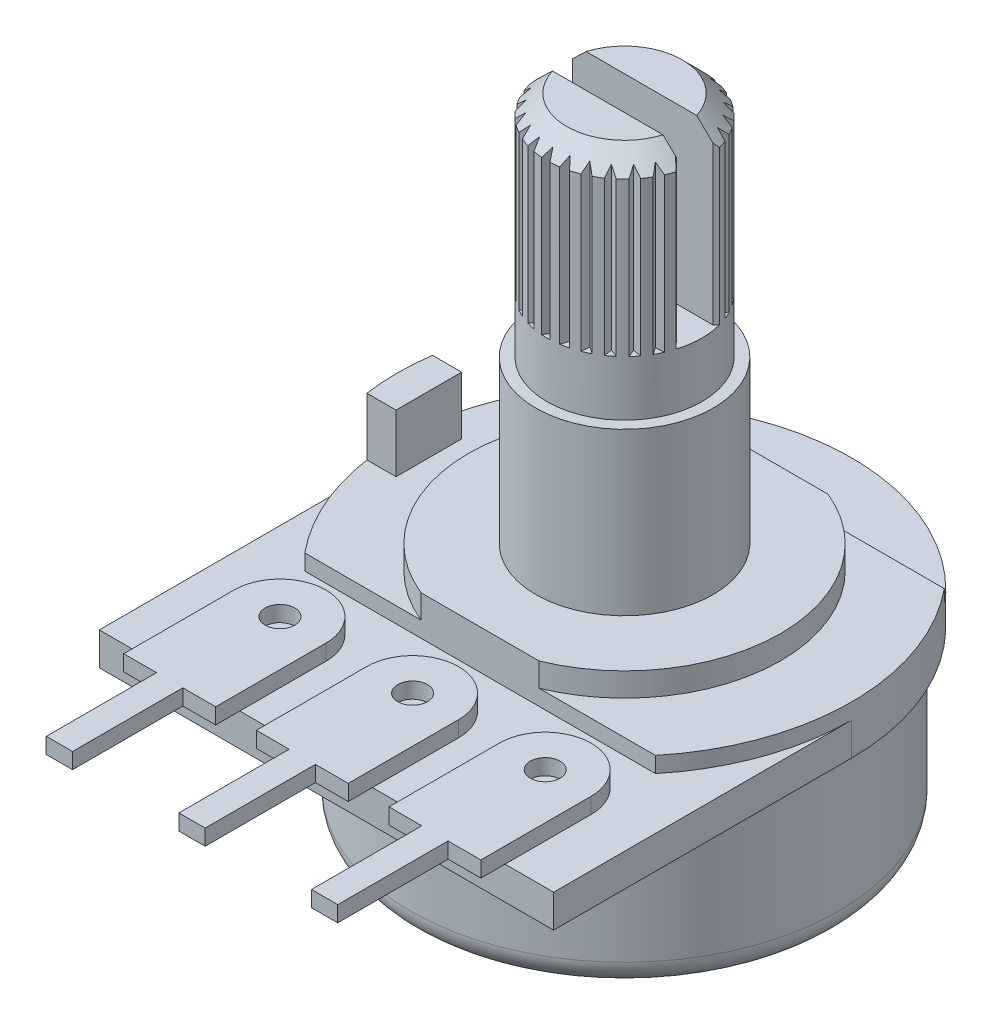
from build123d import *
from build123d.topology import SkipClean

# Parameters (mm, degrees)
CROQUIS1_R                = 8.15
SALIENTE_EXTRUIR1_DEPTH   = 6.3
REDONDEO1_R               = 1
SALIENTE_EXTRUIR2_DEPTH   = 1.25
CROQUIS11_W               = 3.9913563
CROQUIS11_H               = 2
CORTAR_EXTRUIR3_DEPTH     = 2.6
CROQUIS3_R                = 0.565497453
SALIENTE_EXTRUIR3_DEPTH   = 0.6
SALIENTE_EXTRUIR3_2_DEPTH = 0.6
SALIENTE_EXTRUIR3_3_DEPTH = 0.6
SALIENTE_EXTRUIR4_DEPTH   = 0.6
SALIENTE_EXTRUIR5_DEPTH   = 0.9
CROQUIS6_R                = 3.375
SALIENTE_EXTRUIR6_DEPTH   = 6.15
CROQUIS7_R                = 2.95
SALIENTE_EXTRUIR7_DEPTH   = 8.7
CHAFL_N1_SIZE             = 0.75
CROQUIS8_W                = 13.62856302
CROQUIS8_H                = 1.28
CORTAR_EXTRUIR1_DEPTH     = 6.6
CORTAR_EXTRUIR2_DEPTH     = 6.6
SALIENTE_EXTRUIR8_DEPTH   = 2.2


with BuildPart() as part:
    # Croquis1 → Saliente-Extruir1 (new body)
    with BuildSketch(Plane(origin=(0, 0, 0), x_dir=(1, 0, 0), z_dir=(0, 1, 0))):
        Circle(CROQUIS1_R)
    extrude(amount=SALIENTE_EXTRUIR1_DEPTH)

    # Redondeo1
    redondeo1_edges = [part.edges().sort_by_distance(p)[0] for p in [
        (-8.15, 0, 0),
    ]]
    fillet(redondeo1_edges, radius=REDONDEO1_R)

    # Croquis2 → Saliente-Extruir2 (add)
    with BuildSketch(Plane(origin=(0, 6.3, 0), x_dir=(1, 0, 0), z_dir=(0, 1, 0))):
        with BuildLine():
            Line((-8.65, 0), (-8.65, -11.35))
            Line((-8.65, -11.35), (8.65, -11.35))
            Line((8.65, -11.35), (8.65, 0))
            ThreePointArc((8.65, 0), (0, 8.65), (-8.65, 0))
        make_face()
    extrude(amount=SALIENTE_EXTRUIR2_DEPTH)

    # Croquis11 → Cortar-Extruir3 (cut)
    with BuildSketch(Plane.XZ):
        with Locations((-8.65, 0)):
            Rectangle(CROQUIS11_W, CROQUIS11_H)
    extrude(amount=-CORTAR_EXTRUIR3_DEPTH, mode=Mode.SUBTRACT)

    # Croquis4 → Saliente-Extruir4 (add)
    with BuildSketch(Plane(origin=(0, 7.55, 0), x_dir=(1, 0, 0), z_dir=(0, 1, 0))):
        with BuildLine():
            Line((-6.676263925, -5.5), (6.676263925, -5.5))
            ThreePointArc((6.676263925, -5.5), (8.65, 0), (6.676263925, 5.5))
            Line((6.676263925, 5.5), (-6.676263925, 5.5))
            ThreePointArc((-6.676263925, 5.5), (-8.65, 0), (-6.676263925, -5.5))
        make_face()
    extrude(amount=SALIENTE_EXTRUIR4_DEPTH)

    # Croquis5 → Saliente-Extruir5 (add)
    with BuildSketch(Plane(origin=(0, 8.15, 0), x_dir=(1, 0, 0), z_dir=(0, 1, 0))):
        with BuildLine():
            Line((-2.25, 5.5), (2.25, 5.5))
            ThreePointArc((2.25, 5.5), (5.942432162, 0), (2.25, -5.5))
            Line((2.25, -5.5), (-2.25, -5.5))
            ThreePointArc((-2.25, -5.5), (-5.942432162, 0), (-2.25, 5.5))
        make_face()
    extrude(amount=SALIENTE_EXTRUIR5_DEPTH)

    # Croquis6 → Saliente-Extruir6 (add)
    with BuildSketch(Plane(origin=(0, 9.05, 0), x_dir=(1, 0, 0), z_dir=(0, 1, 0))):
        Circle(CROQUIS6_R)
    extrude(amount=SALIENTE_EXTRUIR6_DEPTH)

    # Croquis7 → Saliente-Extruir7 (add)
    with BuildSketch(Plane(origin=(0, 15.2, 0), x_dir=(1, 0, 0), z_dir=(0, 1, 0))):
        Circle(CROQUIS7_R)
    extrude(amount=SALIENTE_EXTRUIR7_DEPTH)

    # Chaflán1
    chafl_n1_edges = [part.edges().sort_by_distance(p)[0] for p in [
        (-2.95, 23.9, 0),
    ]]
    chamfer(chafl_n1_edges, length=CHAFL_N1_SIZE)

    # Croquis8 → Cortar-Extruir1 (cut)
    with BuildSketch(Plane(origin=(0, 23.9, 0), x_dir=(1, 0, 0), z_dir=(0, 1, 0))):
        Rectangle(CROQUIS8_W, CROQUIS8_H)
    extrude(amount=-CORTAR_EXTRUIR1_DEPTH, mode=Mode.SUBTRACT)

    # Croquis9 → Cortar-Extruir2 (cut)
    with BuildSketch(Plane(origin=(0, 23.9, 0), x_dir=(1, 0, 0), z_dir=(0, 1, 0))):
        Polygon((0.05460617, 2.669961994), (0.313994159, 3.11923517), (-0.204781819, 3.11923517), align=None)
        Polygon((0.647359516, 2.590869457), (1.000216793, 2.971159158), (0.494447612, 3.086597673), align=None)
        Polygon((1.207651553, 2.381859906), (1.63628438, 2.67409682), (1.168883375, 2.899185281), align=None)
        Polygon((1.707386898, 2.053413954), (2.190301837, 2.242944101), (1.784706445, 2.566395633), align=None)
        Polygon((2.121506734, 1.622001252), (2.634488413, 1.699320799), (2.311036881, 2.104916191), align=None)
        Polygon((2.429245365, 1.109254634), (2.946570739, 1.070486457), (2.721482279, 1.537887462), align=None)
        Polygon((2.615171489, 0.540885357), (3.110899705, 0.387973454), (2.99546119, 0.893742634), align=None)
        Polygon((2.669961995, -0.05460617), (3.11923517, -0.313994159), (3.11923517, 0.204781819), align=None)
        Polygon((2.590869457, -0.647359516), (2.971159158, -1.000216793), (3.086597673, -0.494447612), align=None)
        Polygon((2.381859906, -1.207651553), (2.67409682, -1.63628438), (2.899185281, -1.168883375), align=None)
        Polygon((2.053413954, -1.707386898), (2.242944101, -2.190301837), (2.566395633, -1.784706445), align=None)
        Polygon((1.622001252, -2.121506734), (1.699320799, -2.634488413), (2.104916191, -2.311036881), align=None)
        Polygon((1.109254634, -2.429245365), (1.070486457, -2.946570739), (1.537887462, -2.721482278), align=None)
        Polygon((0.540885357, -2.615171489), (0.387973454, -3.110899705), (0.893742634, -2.99546119), align=None)
        Polygon((-0.05460617, -2.669961994), (-0.313994159, -3.11923517), (0.204781819, -3.11923517), align=None)
        Polygon((-0.647359516, -2.590869457), (-1.000216793, -2.971159158), (-0.494447612, -3.086597673), align=None)
        Polygon((-1.207651553, -2.381859906), (-1.63628438, -2.67409682), (-1.168883375, -2.899185281), align=None)
        Polygon((-1.707386898, -2.053413954), (-2.190301837, -2.242944101), (-1.784706445, -2.566395633), align=None)
        Polygon((-2.121506734, -1.622001252), (-2.634488413, -1.699320799), (-2.311036881, -2.104916191), align=None)
        Polygon((-2.429245365, -1.109254634), (-2.946570739, -1.070486457), (-2.721482278, -1.537887462), align=None)
        Polygon((-2.615171489, -0.540885357), (-3.110899705, -0.387973454), (-2.99546119, -0.893742634), align=None)
        Polygon((-2.669961994, 0.05460617), (-3.11923517, 0.313994159), (-3.11923517, -0.204781819), align=None)
        Polygon((-2.590869457, 0.647359516), (-2.971159158, 1.000216793), (-3.086597673, 0.494447612), align=None)
        Polygon((-2.381859906, 1.207651553), (-2.67409682, 1.63628438), (-2.899185281, 1.168883375), align=None)
        Polygon((-2.053413954, 1.707386898), (-2.242944101, 2.190301837), (-2.566395633, 1.784706445), align=None)
        Polygon((-1.622001252, 2.121506734), (-1.699320799, 2.634488413), (-2.104916191, 2.311036881), align=None)
        Polygon((-1.109254634, 2.429245365), (-1.070486457, 2.946570739), (-1.537887462, 2.721482278), align=None)
        Polygon((-0.540885357, 2.615171489), (-0.387973454, 3.110899705), (-0.893742634, 2.99546119), align=None)
    extrude(amount=-CORTAR_EXTRUIR2_DEPTH, mode=Mode.SUBTRACT)

    # Croquis10 → Saliente-Extruir8 (add)
    with SkipClean():  # the faces are left unmerged after this step: merging them gives an invalid solid
        with BuildSketch(Plane(origin=(0, 8.15, 0), x_dir=(1, 0, 0), z_dir=(0, 1, 0))):
            with BuildLine():
                Line((-8.559205571, 1.25), (-7.45, 1.25))
                Line((-7.45, 1.25), (-7.45, -1.25))
                Line((-7.45, -1.25), (-8.559205571, -1.25))
                ThreePointArc((-8.559205571, -1.25), (-8.65, 0), (-8.559205571, 1.25))
            make_face()
        extrude(amount=SALIENTE_EXTRUIR8_DEPTH)


with BuildPart() as body_2:
    # Croquis3 → Saliente-Extruir3 (new body)
    with BuildSketch(Plane(origin=(0, 7.55, 0), x_dir=(1, 0, 0), z_dir=(0, 1, 0))):
        with BuildLine():
            Line((-5.550000071, -16.47), (-5.549999929, -12.27))
            Line((-5.549999929, -12.27), (-6.8, -12.27))
            Line((-6.8, -12.27), (-6.8, -8.07))
            ThreePointArc((-6.8, -8.07), (-5.05, -6.32), (-3.3, -8.07))
            Line((-3.3, -8.07), (-3.3, -12.27))
            Line((-3.3, -12.27), (-4.550000071, -12.27))
            Line((-4.550000071, -12.27), (-4.550000071, -16.47))
            Line((-4.550000071, -16.47), (-5.550000071, -16.47))
        make_face()
        with Locations((-5.05, -8.07)):
            Circle(CROQUIS3_R, mode=Mode.SUBTRACT)
    extrude(amount=SALIENTE_EXTRUIR3_DEPTH)


with BuildPart() as body_3:
    # Croquis3 → Saliente-Extruir3 2 (new body)
    with BuildSketch(Plane(origin=(0, 7.55, 0), x_dir=(1, 0, 0), z_dir=(0, 1, 0))):
        with BuildLine():
            Line((-0.500000071, -16.47), (-0.499999929, -12.27))
            Line((-0.499999929, -12.27), (-1.75, -12.27))
            Line((-1.75, -12.27), (-1.75, -8.07))
            ThreePointArc((-1.75, -8.07), (0, -6.32), (1.75, -8.07))
            Line((1.75, -8.07), (1.75, -12.27))
            Line((1.75, -12.27), (0.499999929, -12.27))
            Line((0.499999929, -12.27), (0.499999929, -16.47))
            Line((0.499999929, -16.47), (-0.500000071, -16.47))
        make_face()
        with Locations((0, -8.07)):
            Circle(CROQUIS3_R, mode=Mode.SUBTRACT)
    extrude(amount=SALIENTE_EXTRUIR3_2_DEPTH)


with BuildPart() as body_4:
    # Croquis3 → Saliente-Extruir3 3 (new body)
    with BuildSketch(Plane(origin=(0, 7.55, 0), x_dir=(1, 0, 0), z_dir=(0, 1, 0))):
        with BuildLine():
            Line((4.549999929, -16.47), (4.550000071, -12.27))
            Line((4.550000071, -12.27), (3.3, -12.27))
            Line((3.3, -12.27), (3.3, -8.07))
            ThreePointArc((3.3, -8.07), (5.05, -6.32), (6.8, -8.07))
            Line((6.8, -8.07), (6.8, -12.27))
            Line((6.8, -12.27), (5.549999929, -12.27))
            Line((5.549999929, -12.27), (5.549999929, -16.47))
            Line((5.549999929, -16.47), (4.549999929, -16.47))
        make_face()
        with Locations((5.05, -8.07)):
            Circle(CROQUIS3_R, mode=Mode.SUBTRACT)
    extrude(amount=SALIENTE_EXTRUIR3_3_DEPTH)


solid = Compound([part.part, body_2.part, body_3.part, body_4.part])
